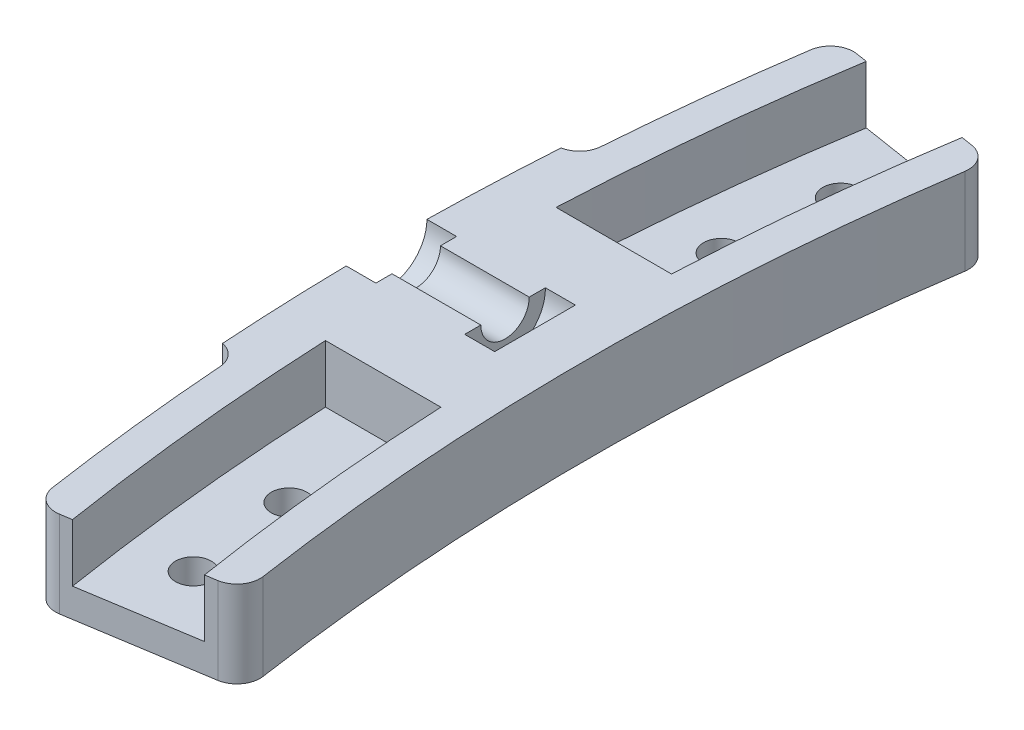
from build123d import *

# Parameters (mm, degrees)
BOSS_EXTRUDE1_DEPTH            = 7.5
BOSS_EXTRUDE2_DEPTH            = 7.5
CUT_EXTRUDE1_DEPTH             = 5
F_3_1_3_1_DIAMETER_HOLE2_D     = 3.1
FILLET1_R                      = 2
FILLET2_R                      = 2
CUT_EXTRUDE2_REACH             = 39.378
CUT_EXTRUDE2_END_RADIUS        = 224.5
SKETCH22_R                     = 2.1
CUT_EXTRUDE2_DIRECTION_2_DEPTH = 0.9
SKETCH23_R                     = 3.5
CUT_EXTRUDE3_DEPTH             = 2.6
SKETCH24_W                     = 2.6
SKETCH24_H                     = 3.5


with BuildPart() as part:
    # Sketch1 → Boss-Extrude1 (new body)
    with BuildSketch(Plane(origin=(0, 0, 0), x_dir=(1, 0, 0), z_dir=(0, 1, 0))):
        with BuildLine():
            ThreePointArc((-207.414551525, 32.851237658), (-210, 0), (-207.414551525, -32.851237658))
            Line((-207.414551525, -32.851237658), (-217.291434931, -34.415582309))
            ThreePointArc((-217.291434931, -34.415582309), (-220, 0), (-217.291434931, 34.415582309))
            Line((-217.291434931, 34.415582309), (-207.414551525, 32.851237658))
        make_face()
        with BuildLine():
            ThreePointArc((-217.291434931, -34.415582309), (-220, 0), (-217.291434931, 34.415582309))
            Line((-217.291434931, 34.415582309), (-220.254499953, 34.884885704))
            ThreePointArc((-220.254499953, 34.884885704), (-223, 0), (-220.254499953, -34.884885704))
            Line((-220.254499953, -34.884885704), (-217.291434931, -34.415582309))
        make_face()
        with BuildLine():
            Line((-204.451486503, 32.381934263), (-207.414551525, 32.851237658))
            ThreePointArc((-207.414551525, 32.851237658), (-210, 0), (-207.414551525, -32.851237658))
            Line((-207.414551525, -32.851237658), (-204.451486503, -32.381934263))
            ThreePointArc((-204.451486503, -32.381934263), (-207, 0), (-204.451486503, 32.381934263))
        make_face()
    extrude(amount=BOSS_EXTRUDE1_DEPTH)

    # Sketch19 → Boss-Extrude2 (add)
    with BuildSketch(Plane(origin=(0, 0, 0), x_dir=(1, 0, 0), z_dir=(0, 1, 0))):
        with BuildLine():
            Line((-224.019328267, 14.683002512), (-222.522539882, 14.584897818))
            ThreePointArc((-222.522539882, 14.584897818), (-223, 0), (-222.522539882, -14.584897818))
            Line((-222.522539882, -14.584897818), (-224.019328267, -14.683002512))
            ThreePointArc((-224.019328267, -14.683002512), (-224.5, 0), (-224.019328267, 14.683002512))
        make_face()
    extrude(amount=BOSS_EXTRUDE2_DEPTH)

    # Sketch15 → Cut-Extrude1 (cut)
    with BuildSketch(Plane(origin=(0, 7.5, 0), x_dir=(1, 0, 0), z_dir=(0, 1, 0))):
        with BuildLine():
            Line((-219.772609758, 10), (-209.761769634, 10))
            ThreePointArc((-209.761769634, 10), (-208.900850883, 21.457737542), (-207.414551525, 32.851237658))
            Line((-207.414551525, 32.851237658), (-217.291434931, 34.415582309))
            ThreePointArc((-217.291434931, 34.415582309), (-218.872736893, 22.242415451), (-219.772609758, 10))
        make_face()
        with BuildLine():
            ThreePointArc((-207.414551525, -32.851237658), (-208.900850883, -21.457737542), (-209.761769634, -10))
            Line((-209.761769634, -10), (-219.772609758, -10))
            ThreePointArc((-219.772609758, -10), (-218.872736893, -22.242415451), (-217.291434931, -34.415582309))
            Line((-217.291434931, -34.415582309), (-207.414551525, -32.851237658))
        make_face()
    extrude(amount=-CUT_EXTRUDE1_DEPTH, mode=Mode.SUBTRACT)

    # Ø3.1 (3.1) Diameter Hole2 (through all)
    with Locations(Plane(origin=(0, 0, 0), x_dir=(-1, 0, 0), z_dir=(0, -1, 0))):
        with Locations((213.160645195, -28.063131327), (214.18186009, -18.738484691), (214.18186009, 18.738484691), (213.160645195, 28.063131327)):
            Hole(F_3_1_3_1_DIAMETER_HOLE2_D / 2)

    # Fillet1
    fillet1_edges = [part.edges().sort_by_distance(p)[0] for p in [
        (-220.254499953, 3.75, 34.884885704),
        (-220.254499953, 3.75, -34.884885704),
        (-204.451486503, 3.75, -32.381934263),
        (-204.451486503, 3.75, 32.381934263),
    ]]
    fillet(fillet1_edges, radius=FILLET1_R)

    # Fillet2
    # the kernel refuses this fillet: 2 mm, written as the material it adds along each edge
    with BuildSketch(Plane(origin=(-222.522539882, 0, -14.584897818), x_dir=(0.06970140258603677, 0, -0.9975678996827931), z_dir=(0, 1, 0))) as fillet2_piece_1:
        with BuildLine():
            CenterArc((1.930030715, 1.99998144), FILLET2_R, 194.477374901, 75.275788142)
            Line((-0.006462156, 1.49998608), (-0.045192014, 1.489986173))
            ThreePointArc((-0.045192014, 1.489986173), (-0.043230707, 0.749820716), (-0.039999629, -0.000172324))
            Line((-0.039999629, -0.000172324), (0.000172324, -0.039999629))
            ThreePointArc((0.000172324, -0.039999629), (0.960707253, -0.037930577), (1.921242182, -0.039999629))
            Line((1.921242182, -0.039999629), (1.921414506, 0))
        make_face()
    extrude(amount=7.5)
    with BuildSketch(Plane(origin=(-222.522539882, 0, 14.584897818), x_dir=(-0.9978589232386029, 0, 0.06540312923015226), z_dir=(0, 1, 0))) as fillet2_piece_2:
        with BuildLine():
            CenterArc((1.991648107, 1.938628933), FILLET2_R, 180.493673912, 75.275788142)
            Line((-0.008277654, 1.921396676), (-0.048276169, 1.92105203))
            ThreePointArc((-0.048276169, 1.92105203), (-0.042069052, 0.960534929), (-0.04, 0))
            Line((-0.04, 0), (0, -0.04))
            ThreePointArc((0, -0.04), (0.75, -0.04), (1.490167038, -0.038772579))
            Line((1.490167038, -0.038772579), (1.5, 0))
        make_face()
    extrude(amount=7.5)

    # Cut-Extrude2: up to this cylinder (the profile starts inside it)
    cut_extrude2_end = Plane(origin=(0, 7.5, 0), z_dir=(0, -1, 0)) * Cylinder(CUT_EXTRUDE2_END_RADIUS, 528.756, mode=Mode.PRIVATE)
    # Sketch22 → Cut-Extrude2 (cut, up to the surface)
    with BuildSketch(Plane(origin=(-212.5, 0, 0), x_dir=(0, 0, -1), z_dir=(1, 0, 0)), mode=Mode.PRIVATE) as cut_extrude2_sk1:
        with Locations((0, 7.5)):
            Circle(SKETCH22_R)
    cut_extrude2_tool1 = extrude(cut_extrude2_sk1.sketch, amount=-CUT_EXTRUDE2_REACH, mode=Mode.PRIVATE) & cut_extrude2_end
    add(cut_extrude2_tool1.solids().sort_by_distance((-212.5, 7.5, 0))[0], mode=Mode.SUBTRACT)

    # Sketch22 → Cut-Extrude2 direction 2 (cut)
    with BuildSketch(Plane(origin=(-212.5, 0, 0), x_dir=(0, 0, -1), z_dir=(1, 0, 0))):
        with Locations((0, 7.5)):
            Circle(SKETCH22_R)
    extrude(amount=CUT_EXTRUDE2_DIRECTION_2_DEPTH, mode=Mode.SUBTRACT)

    # Sketch23 → Cut-Extrude3 (cut)
    with BuildSketch(Plane.ZY.offset(211.6)):
        with Locations((0, 7.439199918)):
            Circle(SKETCH23_R)
    extrude(amount=CUT_EXTRUDE3_DEPTH, mode=Mode.SUBTRACT)

    # Sketch24 → Cut-Revolve1 (revolve, cut)
    with BuildSketch(Plane(origin=(0, 7.5, 0), x_dir=(1, 0, 0), z_dir=(0, 1, 0))):
        with Locations((-223.2, 1.75)):
            Rectangle(SKETCH24_W, SKETCH24_H)
    revolve(axis=Axis((-224.5, 7.5, 0), (1, 0, 0)), mode=Mode.SUBTRACT)


solid = part.part
